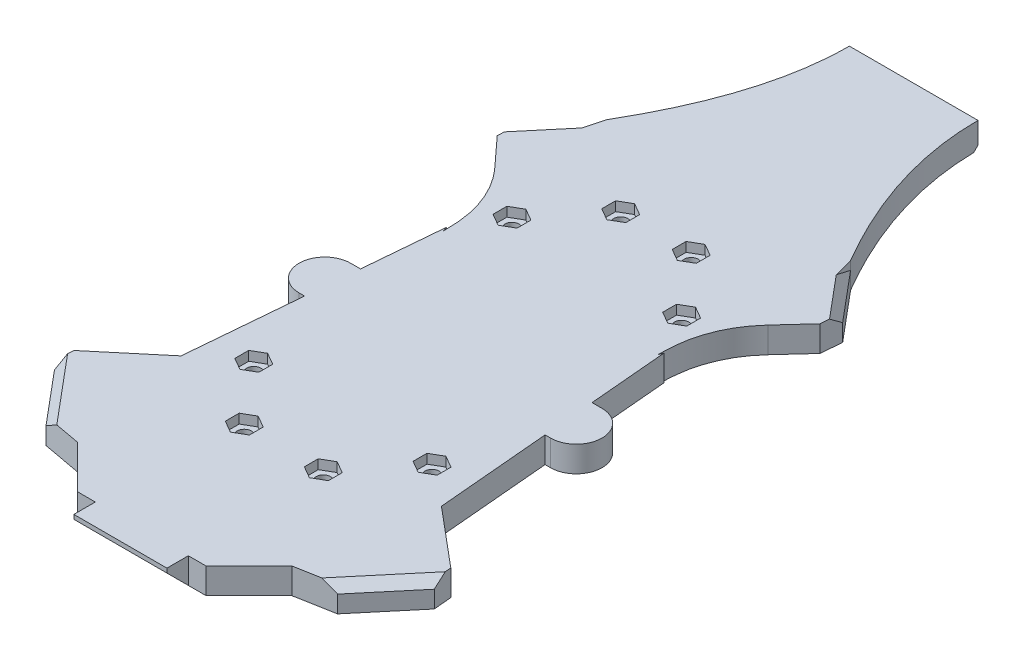
from build123d import *
from OCP.BRepFilletAPI import BRepFilletAPI_MakeChamfer

# Parameters (mm, degrees)
SKETCH1_W                  = 50
SKETCH1_H                  = 180
BOSS_EXTRUDE1_DEPTH        = 6
CHAMFER2_SIZE              = 10
F_3_3_3_3_DIAMETER_HOLE1_D = 3.3
BOSS_EXTRUDE3_DEPTH        = 6
CUT_EXTRUDE3_DEPTH         = 2.2
BOSS_EXTRUDE4_DEPTH        = 6
CHAMFER14_SIZE             = 2
CHAMFER16_SIZE             = 7
CHAMFER16_SIZE_2           = 56.79198309
CHAMFER17_SIZE             = 2
SKETCH59_W                 = 21.7
SKETCH59_H                 = 5
BOSS_EXTRUDE5_DEPTH        = 6
CHAMFER19_SIZE             = 5
CUT_EXTRUDE28_DEPTH        = 106.814167745
CHAMFER20_SIZE             = 3
CHAMFER20_SIZE2            = 3.484649721
CUT_EXTRUDE29_DEPTH        = 105.986313168
CHAMFER24_SIZE             = 1
CUT_EXTRUDE31_DEPTH        = 105.986313306
SKETCH66_R                 = 6
BOSS_EXTRUDE6_DEPTH        = 6


with BuildPart() as part:
    # Sketch1 → Boss-Extrude1 (new body)
    with BuildSketch(Plane(origin=(0, 0, 0), x_dir=(1, 0, 0), z_dir=(0, 1, 0))):
        Rectangle(SKETCH1_W, SKETCH1_H)
    extrude(amount=BOSS_EXTRUDE1_DEPTH)

    # Chamfer2
    chamfer2_edges = [part.edges().sort_by_distance(p)[0] for p in [
        (-25, 3, -90),
        (25, 3, -90),
        (25, 3, 90),
        (-25, 3, 90),
    ]]
    chamfer(chamfer2_edges, length=CHAMFER2_SIZE)

    # Ø3.3 (3.3) Diameter Hole1 (through all)
    with Locations(Plane(origin=(0, 6, 0), x_dir=(1, 0, 0), z_dir=(0, 1, 0))):
        with Locations((-19.785088487, 16.105600012), (9.214911513, -56.894399988), (20.785088487, -43.105600012), (-9.214911513, -56.894399988), (-20.785088487, -43.105600012), (19.785088487, 16.105600012), (8.214911513, 29.894399988), (-8.214911513, 29.894399988)):
            Hole(F_3_3_3_3_DIAMETER_HOLE1_D / 2)

    # Sketch52 → Boss-Extrude3 (add, through all)
    with BuildSketch(Plane(origin=(0, 6, 0), x_dir=(1, 0, 0), z_dir=(0, 1, 0))):
        Polygon((40, 33.067924807), (31.85, 24.173760523), (25, 5.3535402), (25, 59.656998575), (28.429823026, 46.856724783), align=None)
        Polygon((-28.429823026, 46.856724783), (-40, 33.067924807), (-31.85, 24.173760523), (-25, 5.3535402), (-25, 59.656998575), align=None)
    extrude(amount=-BOSS_EXTRUDE3_DEPTH)

    # Sketch11 → Cut-Extrude3 (cut)
    with BuildSketch(Plane(origin=(0, 6, 0), x_dir=(1, 0, 0), z_dir=(0, 1, 0))):
        Polygon((23.585088487, -44.722180766), (23.585088487, -41.489019258), (20.785088487, -39.872438504), (17.985088487, -41.489019258), (17.985088487, -44.722180766), (20.785088487, -46.338761519), align=None)
        Polygon((9.214911513, -60.127561496), (12.014911513, -58.510980742), (12.014911513, -55.277819234), (9.214911513, -53.661238481), (6.414911513, -55.277819234), (6.414911513, -58.510980742), align=None)
        Polygon((-6.414911513, -58.510980742), (-9.214911513, -60.127561496), (-12.014911513, -58.510980742), (-12.014911513, -55.277819234), (-9.214911513, -53.661238481), (-6.414911513, -55.277819234), align=None)
        Polygon((-20.785088487, -46.338761519), (-23.585088487, -44.722180766), (-23.585088487, -41.489019258), (-20.785088487, -39.872438504), (-17.985088487, -41.489019258), (-17.985088487, -44.722180766), align=None)
        Polygon((19.785088487, 12.872438504), (22.585088487, 14.489019258), (22.585088487, 17.722180766), (19.785088487, 19.338761519), (16.985088487, 17.722180766), (16.985088487, 14.489019258), align=None)
        Polygon((8.214911513, 26.661238481), (11.014911513, 28.277819234), (11.014911513, 31.510980742), (8.214911513, 33.127561496), (5.414911513, 31.510980742), (5.414911513, 28.277819234), align=None)
        Polygon((-19.785088487, 12.872438504), (-16.985088487, 14.489019258), (-16.985088487, 17.722180766), (-19.785088487, 19.338761519), (-22.585088487, 17.722180766), (-22.585088487, 14.489019258), align=None)
        Polygon((-8.214911513, 26.661238481), (-5.414911513, 28.277819234), (-5.414911513, 31.510980742), (-8.214911513, 33.127561496), (-11.014911513, 31.510980742), (-11.014911513, 28.277819234), align=None)
    extrude(amount=-CUT_EXTRUDE3_DEPTH, mode=Mode.SUBTRACT)

    # Sketch53 → Boss-Extrude4 (add, through all)
    with BuildSketch(Plane(origin=(0, 6, 0), x_dir=(1, 0, 0), z_dir=(0, 1, 0))):
        Polygon((25, -45.989627063), (25, -80), (34, -78.344262241), (46.212964584, -63.789417822), align=None)
        Polygon((-46.212964584, -63.789417822), (-25, -45.989627063), (-25, -80), (-34, -78.344262241), align=None)
    extrude(amount=-BOSS_EXTRUDE4_DEPTH)

    # Chamfer14
    chamfer14_edges = [part.edges().sort_by_distance(p)[0] for p in [
        (-40.106482292, 6, 71.066840031),
        (40.106482292, 6, 71.066840031),
    ]]
    chamfer(chamfer14_edges, length=CHAMFER14_SIZE)

    # Chamfer16
    # the kernel refuses this chamfer: 56.79198309, 7 mm, written as the material it adds along each edge
    with BuildSketch(Plane(origin=(25, 6, 45.989627063), x_dir=(0.6351042832999635, 0, 0.7724264038301901), z_dir=(0, -1, 0))) as chamfer16_piece_1:
        Polygon((CHAMFER16_SIZE * 0.9830242288, -CHAMFER16_SIZE * 0.183475790208), (-CHAMFER16_SIZE_2 * 0.772426403828, -CHAMFER16_SIZE_2 * 0.635104283298), (0, 0), align=None)
    extrude(amount=6)
    with BuildSketch(Plane(origin=(-25, 6, 45.989627063), x_dir=(-0.6351042832999635, 0, 0.7724264038301901), z_dir=(0, -1, 0))) as chamfer16_piece_2:
        Polygon((CHAMFER16_SIZE * 0.9830242288, CHAMFER16_SIZE * 0.183475790208), (-CHAMFER16_SIZE_2 * 0.772426403828, CHAMFER16_SIZE_2 * 0.635104283298), (0, 0), align=None)
    extrude(amount=6)

    # Chamfer17
    chamfer17_edges = [part.edges().sort_by_distance(p)[0] for p in [
        (-34.214911513, 6, -39.962324795),
        (34.214911513, 6, -39.962324795),
    ]]
    chamfer(chamfer17_edges, length=CHAMFER17_SIZE)

    # Sketch59 → Boss-Extrude5 (add, through all)
    with BuildSketch(Plane(origin=(0, 6, 0), x_dir=(1, 0, 0), z_dir=(0, 1, 0))):
        with Locations((0, -92.5)):
            Rectangle(SKETCH59_W, SKETCH59_H)
    extrude(amount=-BOSS_EXTRUDE5_DEPTH)

    # Chamfer19
    chamfer19_edges = [part.edges().sort_by_distance(p)[0] for p in [
        (0, 0, 95),
    ]]
    chamfer(chamfer19_edges, length=CHAMFER19_SIZE)

    # Sketch61 → Cut-Extrude28 (cut, through all)
    with BuildSketch(Plane.XZ):
        Polygon((25, -59.656998575), (15, -90), (25, -80), align=None)
        Polygon((-25, -80), (-25, -59.656998575), (-15, -90), align=None)
    extrude(amount=-CUT_EXTRUDE28_DEPTH, mode=Mode.SUBTRACT)

    # Chamfer20: one chamfer whose edges measure the first distance from different faces: ONE call of the kernel's chamfer builder (chamfer() names one face for all edges)
    chamfer20_edges_1 = [part.edges().sort_by_distance(p)[0] for p in [
        (-40, 2, -33.067924807),
    ]]
    chamfer20_side_1 = [part.faces().sort_by_distance(p)[0] for p in [
        (-35.821197815, 2.933105821, -28.507562458),
    ]]
    chamfer20_edges_2 = [part.edges().sort_by_distance(p)[0] for p in [
        (40, 2, -33.067924807),
    ]]
    chamfer20_side_2 = [part.faces().sort_by_distance(p)[0] for p in [
        (34.214911513, 2, -39.962324795),
    ]]
    chamfer20_edges_3 = [part.edges().sort_by_distance(p)[0] for p in [
        (-46.212964584, 2, 63.789417822),
        (46.212964584, 2, 63.789417822),
    ]]
    chamfer20 = BRepFilletAPI_MakeChamfer(part.part.solid().wrapped)
    for e in chamfer20_edges_1:
        chamfer20.Add(CHAMFER20_SIZE, CHAMFER20_SIZE2, e.wrapped, chamfer20_side_1[0].wrapped)  # the first distance lies on this face
    for e in chamfer20_edges_2:
        chamfer20.Add(CHAMFER20_SIZE, CHAMFER20_SIZE2, e.wrapped, chamfer20_side_2[0].wrapped)  # the first distance lies on this face
    for e in chamfer20_edges_3:
        chamfer20.Add(CHAMFER20_SIZE, e.wrapped)
    add(Compound.cast(chamfer20.Shape()), mode=Mode.REPLACE)

    # Sketch62 → Cut-Extrude29 (cut, through all)
    with BuildSketch(Plane(origin=(0, 6, 0), x_dir=(1, 0, 0), z_dir=(0, 1, 0))):
        with BuildLine():
            Line((15, 90), (25, 59.656998575))
            Line((25, 59.656998575), (28.429823026, 46.856724783))
            add(Edge.make_bspline(
                [(28.429823026, 46.856724783), (20.791344098, 59.90516311), (15, 74.573823319), (15, 90)],
                knots=[0, 0, 0, 0, 1, 1, 1, 1], degree=3))
        make_face()
        with BuildLine():
            Line((-25, 59.656998575), (-28.429823026, 46.856724783))
            add(Edge.make_bspline(
                [(-28.429823026, 46.856724783), (-20.791344098, 59.90516311), (-15, 74.573823319), (-15, 90)],
                knots=[0, 0, 0, 0, 1, 1, 1, 1], degree=3))
            Line((-15, 90), (-25, 59.656998575))
        make_face()
    extrude(amount=-CUT_EXTRUDE29_DEPTH, mode=Mode.SUBTRACT)

    # Chamfer24
    chamfer24_edges = [part.edges().sort_by_distance(p)[0] for p in [
        (0, 0, -90),
    ]]
    chamfer(chamfer24_edges, length=CHAMFER24_SIZE)

    # Sketch64 → Cut-Extrude31 (cut, through all)
    with BuildSketch(Plane(origin=(0, 6, 0), x_dir=(1, 0, 0), z_dir=(0, 1, 0))):
        with BuildLine():
            Line((31.85, 24.173760523), (25, 5.3535402))
            add(Edge.make_bspline(
                [(25, 5.3535402), (25, 9.939182196), (26.103782981, 15.682971222), (29.276150019, 21.364896158), (31.85, 24.173760523)],
                knots=[0, 0, 0, 0, 0.526973907, 1, 1, 1, 1], degree=3))
        make_face()
        with BuildLine():
            Line((-31.85, 24.173760523), (-25, 5.3535402))
            add(Edge.make_bspline(
                [(-25, 5.3535402), (-25, 9.939182196), (-26.103782981, 15.682971222), (-29.276150019, 21.364896158), (-31.85, 24.173760523)],
                knots=[0, 0, 0, 0, 0.526973907, 1, 1, 1, 1], degree=3))
        make_face()
    extrude(amount=-CUT_EXTRUDE31_DEPTH, mode=Mode.SUBTRACT)

    # Sketch66 → Boss-Extrude6 (add)
    with BuildSketch(Plane(origin=(0, 6, 0), x_dir=(1, 0, 0), z_dir=(0, 1, 0))):
        with Locations((29.320888862, -18)):
            Circle(SKETCH66_R)
        with BuildLine():
            ThreePointArc((25, -13.837078017), (26.973287097, -12.478336668), (29.320888862, -12))
            Line((29.320888862, -12), (25, -12))
            Line((25, -12), (25, -13.837078017))
        make_face()
        with BuildLine():
            Line((25, -24), (29.320888862, -24))
            ThreePointArc((29.320888862, -24), (26.973287097, -23.521663332), (25, -22.162921983))
            Line((25, -22.162921983), (25, -24))
        make_face()
        with Locations((-29.320888862, -18)):
            Circle(SKETCH66_R)
        with BuildLine():
            Line((-25, -12), (-29.320888862, -12))
            ThreePointArc((-29.320888862, -12), (-26.973287097, -12.478336668), (-25, -13.837078017))
            Line((-25, -13.837078017), (-25, -12))
        make_face()
        with BuildLine():
            ThreePointArc((-25, -22.162921983), (-26.973287097, -23.521663332), (-29.320888862, -24))
            Line((-29.320888862, -24), (-25, -24))
            Line((-25, -24), (-25, -22.162921983))
        make_face()
    extrude(amount=-BOSS_EXTRUDE6_DEPTH)


solid = part.part
